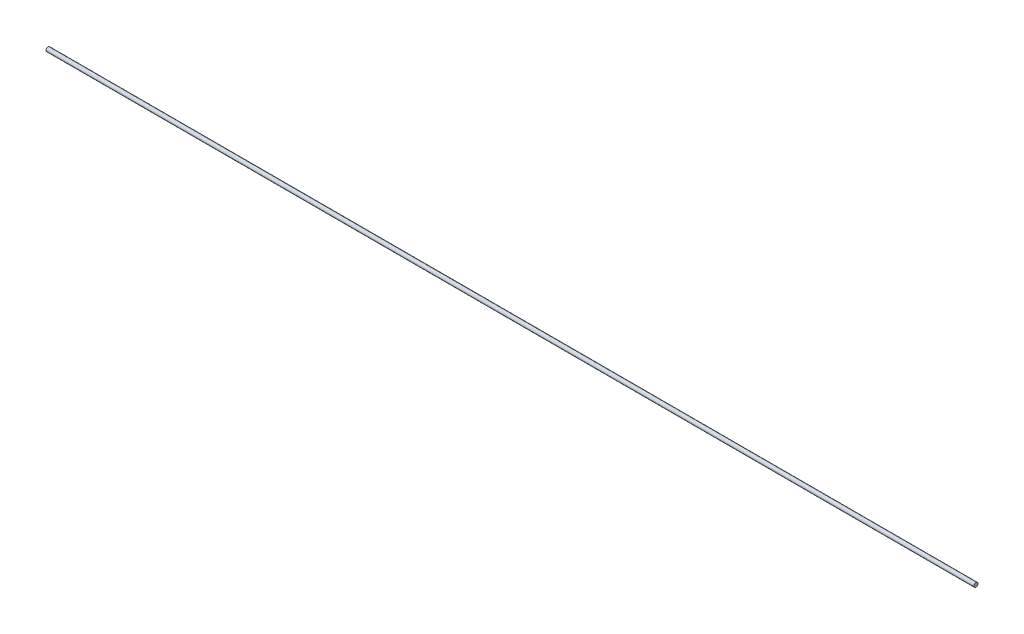
from build123d import *

# Parameters (mm, degrees)
SKETCH1_W = 1445.722352046
SKETCH1_H = 3.175


with BuildPart() as part:
    # Sketch1 → Revolve1 (revolve)
    with BuildSketch(Plane.XY):
        with Locations((722.861176023, 1.5875)):
            Rectangle(SKETCH1_W, SKETCH1_H)
    revolve(axis=Axis((0, 0, 0), (1, 0, 0)))


solid = part.part
